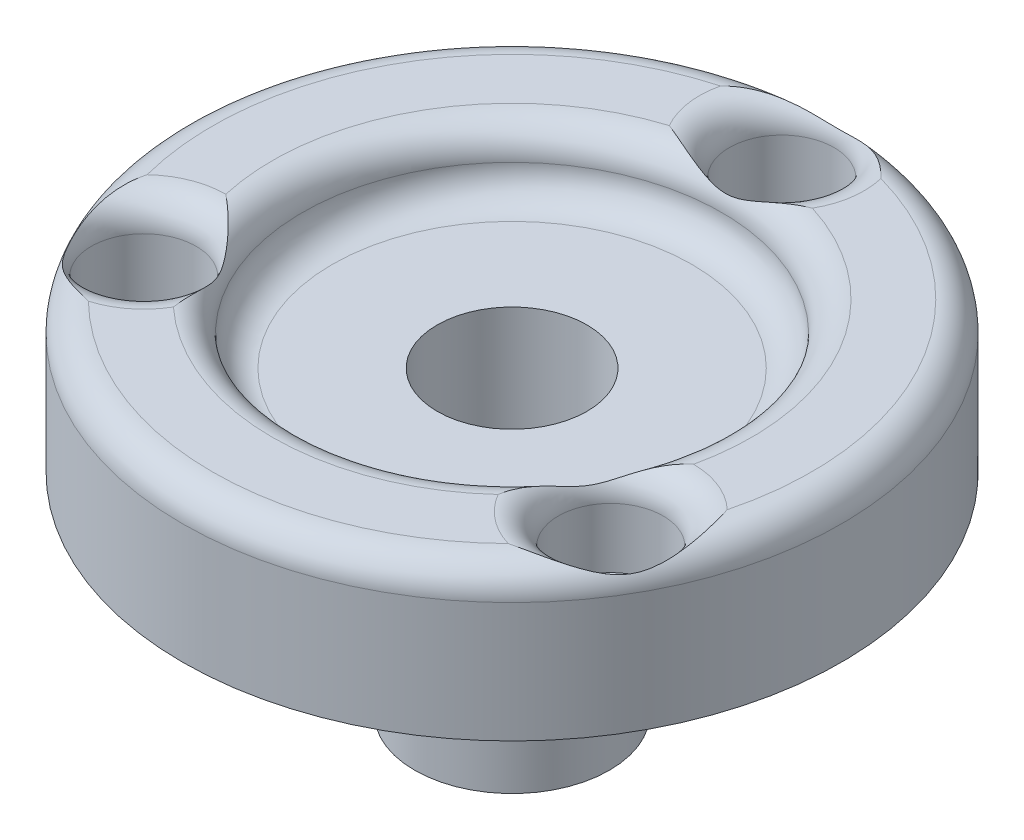
from build123d import *

# Parameters (mm, degrees)
SKETCH1_R           = 11
BOSS_EXTRUDE1_DEPTH = 5
SKETCH2_R           = 1.75
CUT_EXTRUDE1_DEPTH  = 3
SKETCH3_R           = 7
CUT_EXTRUDE2_DEPTH  = 2
SKETCH4_R           = 3.25
BOSS_EXTRUDE3_DEPTH = 7
SKETCH5_R           = 2.5
CUT_EXTRUDE3_DEPTH  = 15
FILLET3_R           = 1


with BuildPart() as part:
    # Sketch1 → Boss-Extrude1 (new body)
    with BuildSketch(Plane(origin=(0, 0, 0), x_dir=(1, 0, 0), z_dir=(0, 1, 0))):
        with Locations(Location((0, 0, 0), (0, 0, 270))):
            Circle(SKETCH1_R)
    extrude(amount=BOSS_EXTRUDE1_DEPTH)

    # Sketch2 → Cut-Extrude1 (cut)
    with BuildSketch(Plane(origin=(0, 5, 0), x_dir=(1, 0, 0), z_dir=(0, 1, 0))):
        with Locations(Location((0, 9, 0), (0, 0, 270))):
            Circle(SKETCH2_R)
        with Locations(Location((7.794228634, -4.5, 0), (0, 0, 270))):
            Circle(SKETCH2_R)
        with Locations(Location((-7.794228634, -4.5, 0), (0, 0, 270))):
            Circle(SKETCH2_R)
    extrude(amount=-CUT_EXTRUDE1_DEPTH, mode=Mode.SUBTRACT)

    # Sketch3 → Cut-Extrude2 (cut)
    with BuildSketch(Plane(origin=(0, 5, 0), x_dir=(1, 0, 0), z_dir=(0, 1, 0))):
        with Locations(Location((0, 0, 0), (0, 0, 270))):
            Circle(SKETCH3_R)
    extrude(amount=-CUT_EXTRUDE2_DEPTH, mode=Mode.SUBTRACT)

    # Sketch4 → Boss-Extrude3 (add)
    with BuildSketch(Plane.XZ):
        with Locations(Location((0, 0, 0), (0, 0, 90))):
            Circle(SKETCH4_R)
    extrude(amount=BOSS_EXTRUDE3_DEPTH)

    # Sketch5 → Cut-Extrude3 (cut)
    with BuildSketch(Plane.XZ.offset(7)):
        with Locations(Location((0, 0, 0), (0, 0, 270))):
            Circle(SKETCH5_R)
    extrude(amount=-CUT_EXTRUDE3_DEPTH, mode=Mode.SUBTRACT)

    # Fillet3
    # the kernel refuses this fillet: 1 mm, written as the material it adds along each edge
    with BuildSketch(Plane(origin=(0, 3, 0), x_dir=(0, 0, 1), z_dir=(-1, 0, 0))) as fillet3_piece_1:
        with BuildLine():
            CenterArc((7 - FILLET3_R, FILLET3_R), FILLET3_R, 270, 90)
            Line((7 - FILLET3_R, 0), (7, 0))
            Line((7, 0), (7, FILLET3_R))
        make_face()
    revolve(axis=Axis((0, 3, 0), (0, 1, 0)))
    # the kernel refuses this fillet: 1 mm, written as the material it takes off along each edge
    with BuildSketch(Plane(origin=(-7.794228634, 5, 4.5), x_dir=(0, 0, 1), z_dir=(-1, 0, 0))) as fillet3_2_piece_1:
        with BuildLine():
            CenterArc((1.75 + FILLET3_R, -FILLET3_R), FILLET3_R, 90, 90)
            Line((1.75, -FILLET3_R), (1.75, 0))
            Line((1.75, 0), (1.75 + FILLET3_R, 0))
        make_face()
    revolve(axis=Axis((-7.794228634, 5, 4.5), (0, 1, 0)), mode=Mode.SUBTRACT)
    with BuildSketch(Plane(origin=(0, 5, 0), x_dir=(0, 0, 1), z_dir=(-1, 0, 0))) as fillet3_2_piece_2:
        with BuildLine():
            CenterArc((7 + FILLET3_R, -FILLET3_R), FILLET3_R, 90, 90)
            Line((7, -FILLET3_R), (7, 0))
            Line((7, 0), (7 + FILLET3_R, 0))
        make_face()
    revolve(axis=Axis((0, 5, 0), (0, 1, 0)), mode=Mode.SUBTRACT)
    with BuildSketch(Plane(origin=(0, 5, 0), x_dir=(0, 0, 1), z_dir=(-1, 0, 0))) as fillet3_2_piece_3:
        with BuildLine():
            CenterArc((11 - FILLET3_R, -FILLET3_R), FILLET3_R, 0, 90)
            Line((11 - FILLET3_R, 0), (11, 0))
            Line((11, 0), (11, -FILLET3_R))
        make_face()
    revolve(axis=Axis((0, 5, 0), (0, 1, 0)), mode=Mode.SUBTRACT)
    with BuildSketch(Plane(origin=(0, 5, -9), x_dir=(0, 0, 1), z_dir=(-1, 0, 0))) as fillet3_2_piece_4:
        with BuildLine():
            CenterArc((1.75 + FILLET3_R, -FILLET3_R), FILLET3_R, 90, 90)
            Line((1.75, -FILLET3_R), (1.75, 0))
            Line((1.75, 0), (1.75 + FILLET3_R, 0))
        make_face()
    revolve(axis=Axis((0, 5, -9), (0, 1, 0)), mode=Mode.SUBTRACT)
    with BuildSketch(Plane(origin=(7.794228634, 5, 4.5), x_dir=(0, 0, 1), z_dir=(-1, 0, 0))) as fillet3_2_piece_5:
        with BuildLine():
            CenterArc((1.75 + FILLET3_R, -FILLET3_R), FILLET3_R, 90, 90)
            Line((1.75, -FILLET3_R), (1.75, 0))
            Line((1.75, 0), (1.75 + FILLET3_R, 0))
        make_face()
    revolve(axis=Axis((7.794228634, 5, 4.5), (0, 1, 0)), mode=Mode.SUBTRACT)


solid = part.part
